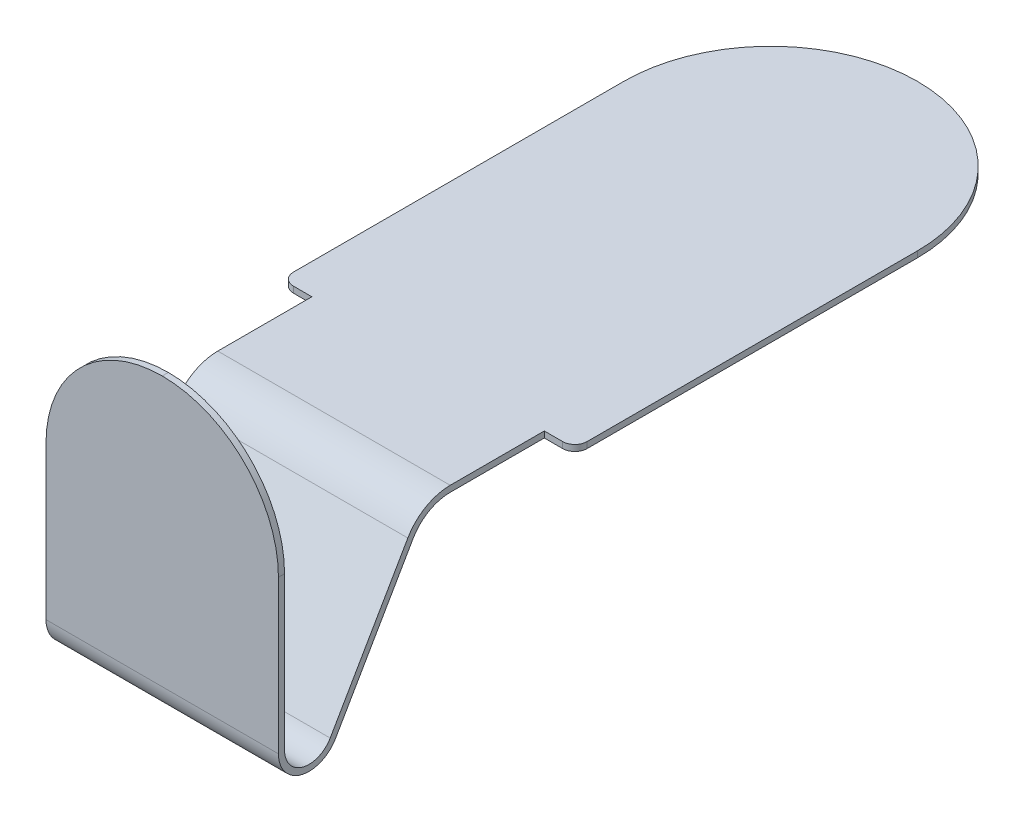
from build123d import *

# Parameters (mm, degrees)
SURFACE_EXTRUDE1_1_BACK  = 4.75
SURFACE_EXTRUDE1_1_DEPTH = 9.5
THICKEN1_T1              = 0.25
FILLET1_R                = 4.75
SKETCH2_W                = 12
SKETCH2_H                = 20
BOSS_EXTRUDE1_DEPTH      = 0.25
FILLET2_R                = 6
FILLET3_R                = 0.5


with BuildPart() as body_1:
    # Surface-Extrude1: a surface, the sketch's curves swept straight by 9.5 mm
    with BuildLine(Plane(origin=(0, 0, 0), x_dir=(0, 0, -1), z_dir=(1, 0, 0)).offset(-SURFACE_EXTRUDE1_1_BACK), mode=Mode.PRIVATE) as surface_extrude1_1_path:
        Line((30.616025404, -5.004809472), (10.616025404, -5.004809472))
        Line((10.616025404, -5.004809472), (6.770725942, -5.004809472))
        ThreePointArc((6.770725942, -5.004809472), (5.770725942, -5.272758664), (5.038675135, -6.004809472))
        Line((5.038675135, -6.004809472), (1.866025404, -11.5))
        ThreePointArc((1.866025404, -11.5), (0.741180955, -11.965925826), (0, -11))
        Line((0, -11), (0, 0))
    surface_extrude1_1 = Shell.extrude(surface_extrude1_1_path.wire(), (1 * SURFACE_EXTRUDE1_1_DEPTH, 0 * SURFACE_EXTRUDE1_1_DEPTH, 0 * SURFACE_EXTRUDE1_1_DEPTH))
    add(Solid.thicken(surface_extrude1_1, THICKEN1_T1))

    # Fillet1
    fillet1_edges = [body_1.edges().sort_by_distance(p)[0] for p in [
        (4.75, 0, 0.125),
        (-4.75, 0, 0.125),
    ]]
    fillet(fillet1_edges, radius=FILLET1_R - 0.0001)  # a hair under: the kernel refuses the full size

    # Sketch2 → Boss-Extrude1 (add)
    with BuildSketch(Plane(origin=(0, -5.004809472, 0), x_dir=(1, 0, 0), z_dir=(0, 1, 0))):
        with Locations((0, 20.616025404)):
            Rectangle(SKETCH2_W, SKETCH2_H)
    extrude(amount=-BOSS_EXTRUDE1_DEPTH)

    # Fillet2
    fillet2_edges = [body_1.edges().sort_by_distance(p)[0] for p in [
        (-6, -5.129809472, -30.616025404),
        (6, -5.129809472, -30.616025404),
    ]]
    fillet(fillet2_edges, radius=FILLET2_R - 0.0001)  # a hair under: the kernel refuses the full size

    # Fillet3
    fillet3_edges = [body_1.edges().sort_by_distance(p)[0] for p in [
        (-6, -5.129809472, -10.616025404),
        (6, -5.129809472, -10.616025404),
    ]]
    fillet(fillet3_edges, radius=FILLET3_R)


solid = body_1.part
